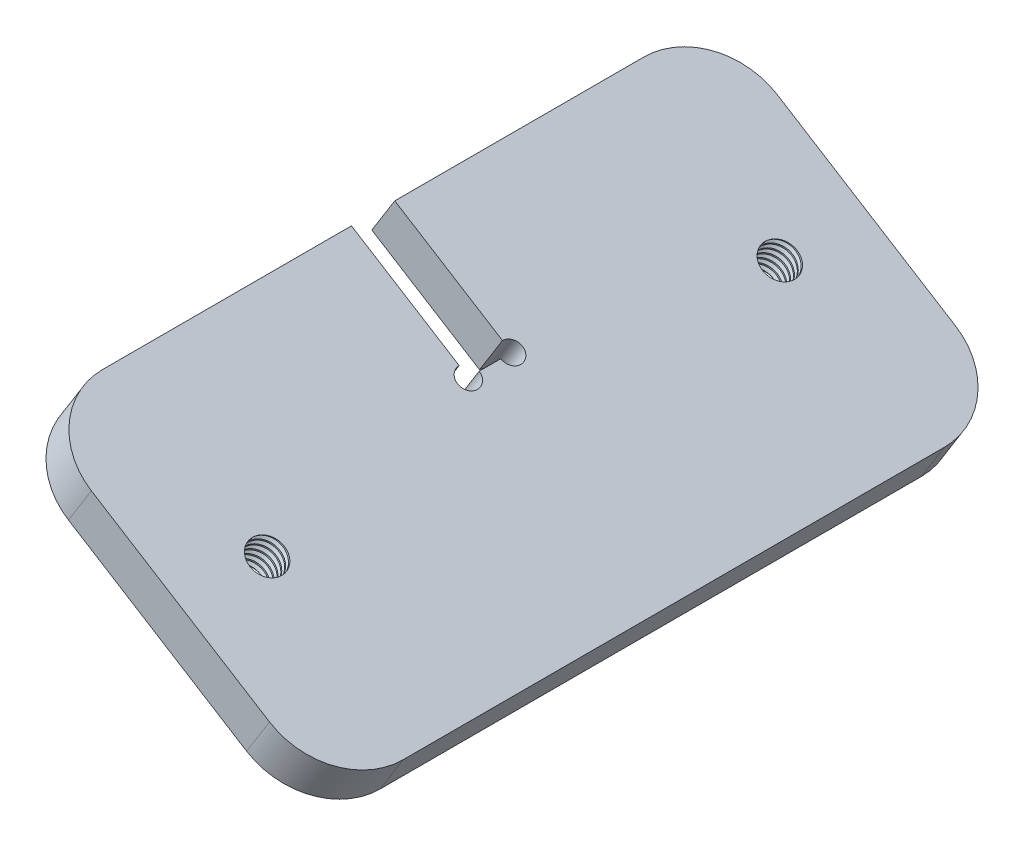
from build123d import *

# Parameters (mm, degrees)
BOSS_EXTRUDE1_DEPTH      = 47.5
BOSS_EXTRUDE1_DEPTH_BACK = 47.5
SKETCH2_W                = 19.078075205
SKETCH2_H                = 44.5
BOSS_EXTRUDE2_DEPTH      = 6
FILLET1_R                = 10
SKETCH3_R                = 1.5
SKETCH3_R_2              = 2.4
CUT_EXTRUDE1_DEPTH       = 538.803313509
THREAD1_PITCH            = 1
THREAD2_PITCH            = 1


with BuildPart() as part:
    # Sketch1 → Boss-Extrude1 (new, two sides: drawn at the far end of the back side and taken through both)
    with BuildSketch(Plane.XY.offset(-BOSS_EXTRUDE1_DEPTH_BACK)):
        Polygon((711, 132.929169143), (685.54330281, 148.802308976), (688.717930776, 153.893648414), (714.174627967, 138.020508582), align=None)
    extrude(amount=BOSS_EXTRUDE1_DEPTH + BOSS_EXTRUDE1_DEPTH_BACK)

    # Sketch2 → Boss-Extrude2 (add)
    with BuildSketch(Plane(origin=(261.902222158, 420.028150272, 0), x_dir=(0.8485565730164436, -0.529104661093237, 0), z_dir=(0.529104661093237, 0.8485565730164437, 0))):
        with Locations((493.451242824, 25.25)):
            Rectangle(SKETCH2_W, SKETCH2_H)
        with Locations((493.451242824, -25.25)):
            Rectangle(SKETCH2_W, SKETCH2_H)
    extrude(amount=-BOSS_EXTRUDE2_DEPTH)

    # Fillet1
    fillet1_edges = [part.edges().sort_by_distance(p)[0] for p in [
        (712.587313983, 135.474838863, 47.5),
        (712.587313983, 135.474838863, -47.5),
        (670.941790678, 161.442277211, -47.5),
        (670.941790678, 161.442277211, 47.5),
    ]]
    fillet(fillet1_edges, radius=FILLET1_R)

    # Sketch3 → Cut-Extrude1 (cut, through all)
    with BuildSketch(Plane(origin=(261.902222158, 420.028150272, 0), x_dir=(0.8485565730164436, -0.529104661093237, 0), z_dir=(0.529104661093237, 0.8485565730164437, 0))):
        with Locations((502.990280426, -3)):
            Circle(SKETCH3_R)
        with Locations((502.990280426, 3)):
            Circle(SKETCH3_R)
        with Locations(Location((508.451242824, -35.5, 0), (0, 0, 180))):
            Circle(SKETCH3_R_2)
        with Locations(Location((508.451242824, 35.5, 0), (0, 0, 180))):
            Circle(SKETCH3_R_2)
    extrude(amount=-CUT_EXTRUDE1_DEPTH, mode=Mode.SUBTRACT)

    # Thread1: the profile of Thread Profile1 profile screwed along a right-hand helix of 10 turns, 8 arcs to a turn; built about Z, then put on its axis
    thread1_z = Axis((0, 0, 0), (0, 0, 1))
    thread1_corners = [(2.3997, 0, -0.000173205), (2.941265875, 0, 0.312499999), (2.941265875, 0, 0.437499999), (2.3997, 0, 0.750173203)]
    with BuildLine(mode=Mode.PRIVATE) as thread1_profile:
        Line(thread1_corners[0], thread1_corners[1])
        Line(thread1_corners[1], thread1_corners[2])
        Line(thread1_corners[2], thread1_corners[3])
        Line(thread1_corners[3], thread1_corners[0])
    thread1_cap = Face(thread1_profile.wire())
    thread1_turn_angles = [0, 22.5, 45, 67.5, 90, 112.5, 135, 157.5, 180, 202.5, 225, 247.5, 270, 292.5, 315, 337.5, 360]
    thread1_turn_weights = [1, 0.9238795325112867, 1, 0.9238795325112867, 1, 0.9238795325112867, 1, 0.9238795325112867, 1, 0.9238795325112867, 1, 0.9238795325112867, 1, 0.9238795325112867, 1, 0.9238795325112867, 1]
    thread1_turn_rails = [Edge.make_bspline([Vector(p[0], p[1], 0).rotate(thread1_z, thread1_turn_angles[k]) / thread1_turn_weights[k] + Vector(0, 0, p[2] + THREAD1_PITCH * thread1_turn_angles[k] / 360) for k in range(17)], [0, 0, 0, 1, 1, 2, 2, 3, 3, 4, 4, 5, 5, 6, 6, 7, 7, 8, 8, 8], 2, thread1_turn_weights) for p in thread1_corners]
    thread1_turn_sides = [Face.make_surface_from_curves(thread1_turn_rails[p[0]], thread1_turn_rails[p[1]]) for p in [(0, 1), (1, 2), (2, 3), (3, 0)]]
    thread1 = Plane(origin=(693.351866314, 151.004227756, 35.5), x_dir=(-0.848556573, 0.529104661, 0), z_dir=(-0.529104661, -0.848556573, 0)) * Solid(Shell([*[p.moved(Location((0, 0, THREAD1_PITCH * i))) for i in range(10) for p in thread1_turn_sides], thread1_cap, thread1_cap.rotate(thread1_z, 3600).moved(Location((0, 0, THREAD1_PITCH * 3600 / 360)))]))
    add(thread1, mode=Mode.SUBTRACT)

    # Thread2: the profile of Thread Profile2 profile screwed along a right-hand helix of 10 turns, 8 arcs to a turn; built about Z, then put on its axis
    thread2_z = Axis((0, 0, 0), (0, 0, 1))
    thread2_corners = [(2.3997, 0, -0.000173205), (2.941265875, 0, 0.312499999), (2.941265875, 0, 0.437499999), (2.3997, 0, 0.750173203)]
    with BuildLine(mode=Mode.PRIVATE) as thread2_profile:
        Line(thread2_corners[0], thread2_corners[1])
        Line(thread2_corners[1], thread2_corners[2])
        Line(thread2_corners[2], thread2_corners[3])
        Line(thread2_corners[3], thread2_corners[0])
    thread2_cap = Face(thread2_profile.wire())
    thread2_turn_angles = [0, 22.5, 45, 67.5, 90, 112.5, 135, 157.5, 180, 202.5, 225, 247.5, 270, 292.5, 315, 337.5, 360]
    thread2_turn_weights = [1, 0.9238795325112867, 1, 0.9238795325112867, 1, 0.9238795325112867, 1, 0.9238795325112867, 1, 0.9238795325112867, 1, 0.9238795325112867, 1, 0.9238795325112867, 1, 0.9238795325112867, 1]
    thread2_turn_rails = [Edge.make_bspline([Vector(p[0], p[1], 0).rotate(thread2_z, thread2_turn_angles[k]) / thread2_turn_weights[k] + Vector(0, 0, p[2] + THREAD2_PITCH * thread2_turn_angles[k] / 360) for k in range(17)], [0, 0, 0, 1, 1, 2, 2, 3, 3, 4, 4, 5, 5, 6, 6, 7, 7, 8, 8, 8], 2, thread2_turn_weights) for p in thread2_corners]
    thread2_turn_sides = [Face.make_surface_from_curves(thread2_turn_rails[p[0]], thread2_turn_rails[p[1]]) for p in [(0, 1), (1, 2), (2, 3), (3, 0)]]
    thread2 = Plane(origin=(693.351866314, 151.004227756, -35.5), x_dir=(-0.848556573, 0.529104661, 0), z_dir=(-0.529104661, -0.848556573, 0)) * Solid(Shell([*[p.moved(Location((0, 0, THREAD2_PITCH * i))) for i in range(10) for p in thread2_turn_sides], thread2_cap, thread2_cap.rotate(thread2_z, 3600).moved(Location((0, 0, THREAD2_PITCH * 3600 / 360)))]))
    add(thread2, mode=Mode.SUBTRACT)


solid = part.part
